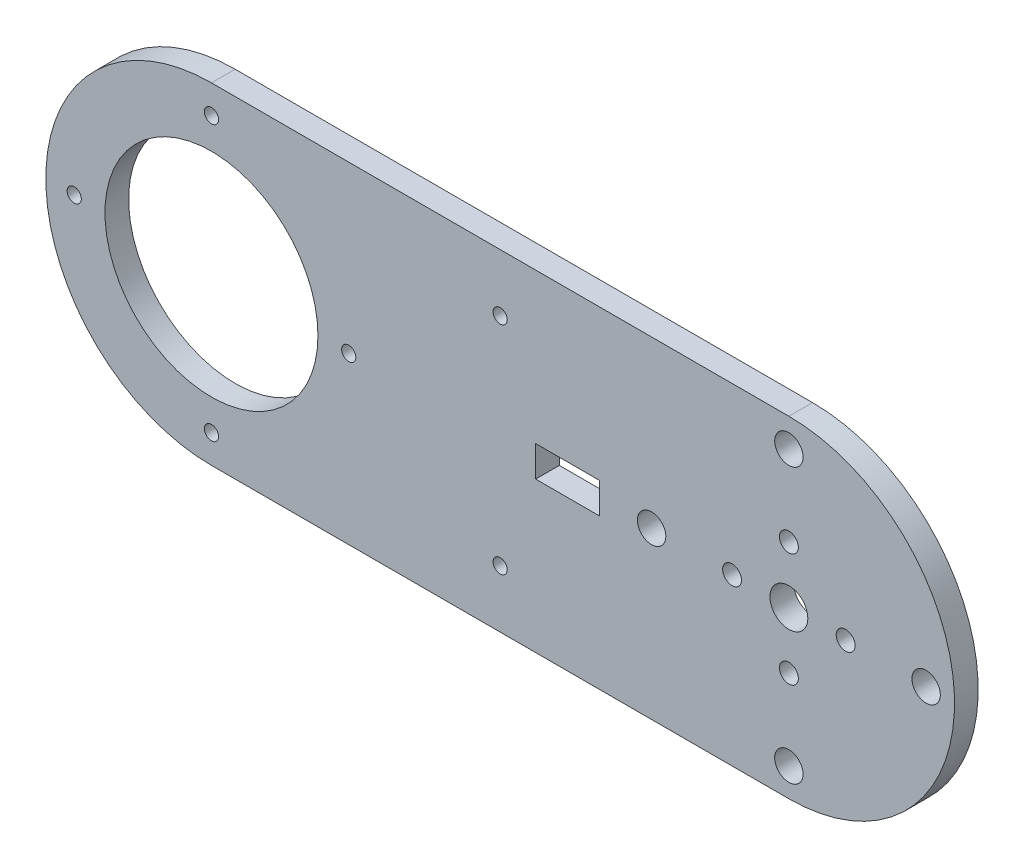
from build123d import *

# Parameters (mm, degrees)
SKETCH1_R           = 4
SKETCH1_R_2         = 22.5
SKETCH1_R_3         = 1.5
SKETCH1_R_4         = 3
SKETCH1_R_5         = 2
SKETCH1_W           = 13.5
SKETCH1_H           = 6.5
BOSS_EXTRUDE1_DEPTH = 5


with BuildPart() as part:
    # Sketch1 → Boss-Extrude1 (new body)
    with BuildSketch(Plane.XY):
        with BuildLine():
            Line((61, -35), (-61, -35))
            ThreePointArc((-61, -35), (-96, 0), (-61, 35))
            Line((-61, 35), (61, 35))
            ThreePointArc((61, 35), (96, 0), (61, -35))
        make_face()
        with Locations((61, 0)):
            Circle(SKETCH1_R, mode=Mode.SUBTRACT)
        with Locations((-61, 0)):
            Circle(SKETCH1_R_2, mode=Mode.SUBTRACT)
        with Locations((-61, -29)):
            Circle(SKETCH1_R_3, mode=Mode.SUBTRACT)
        with Locations((-61, 29)):
            Circle(SKETCH1_R_3, mode=Mode.SUBTRACT)
        with Locations((61, 29)):
            Circle(SKETCH1_R_4, mode=Mode.SUBTRACT)
        with Locations((61, -29)):
            Circle(SKETCH1_R_4, mode=Mode.SUBTRACT)
        with Locations((0, -22.872790913)):
            Circle(SKETCH1_R_3, mode=Mode.SUBTRACT)
        with Locations((0, 22.872790913)):
            Circle(SKETCH1_R_3, mode=Mode.SUBTRACT)
        with Locations((-90, 0)):
            Circle(SKETCH1_R_3, mode=Mode.SUBTRACT)
        with Locations((-32, 0)):
            Circle(SKETCH1_R_3, mode=Mode.SUBTRACT)
        with Locations((90, 0)):
            Circle(SKETCH1_R_4, mode=Mode.SUBTRACT)
        with Locations((32, 0)):
            Circle(SKETCH1_R_4, mode=Mode.SUBTRACT)
        with Locations((61, 12)):
            Circle(SKETCH1_R_5, mode=Mode.SUBTRACT)
        with Locations((61, -12)):
            Circle(SKETCH1_R_5, mode=Mode.SUBTRACT)
        with Locations((49, 0)):
            Circle(SKETCH1_R_5, mode=Mode.SUBTRACT)
        with Locations((73, 0)):
            Circle(SKETCH1_R_5, mode=Mode.SUBTRACT)
        with Locations((14.25, 0)):
            Rectangle(SKETCH1_W, SKETCH1_H, mode=Mode.SUBTRACT)
    extrude(amount=BOSS_EXTRUDE1_DEPTH)


solid = part.part
